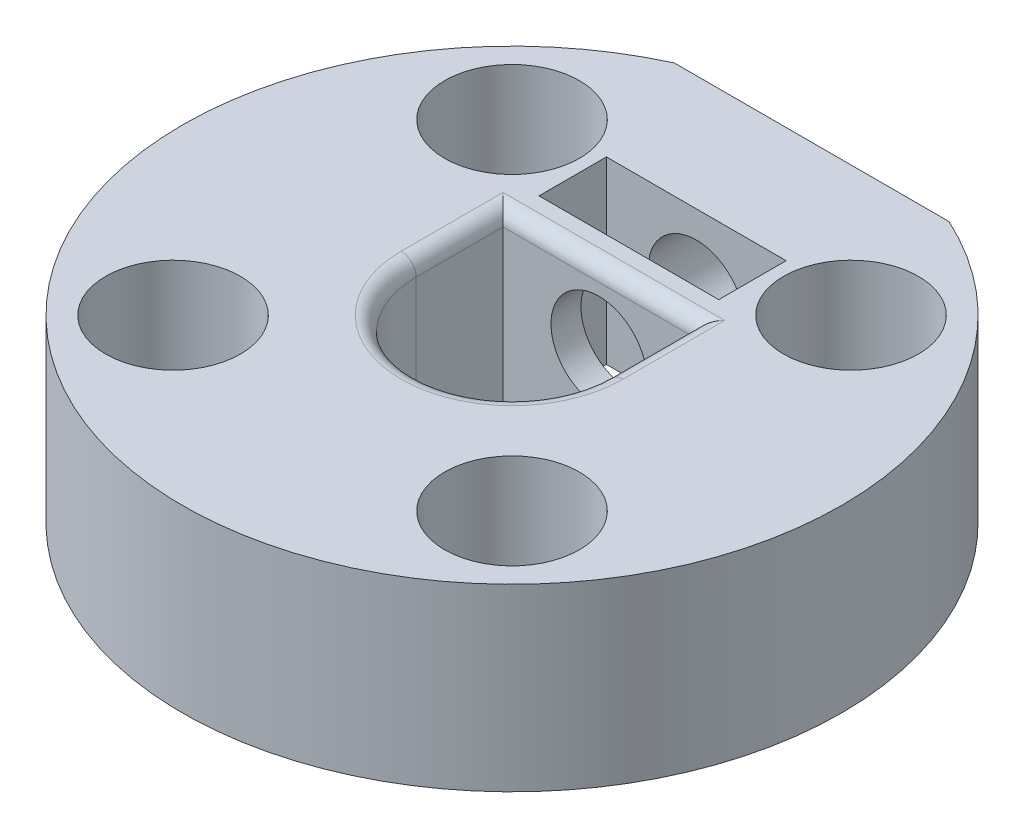
from build123d import *

# Parameters (mm, degrees)
BOSS_EXTRU_1_DEPTH                              = 6
CHAMBRAGE_POUR_VIS_T_TE_CYLINDRIQUE_D           = 2.5
CHAMBRAGE_POUR_VIS_T_TE_CYLINDRIQUE_CBORE_D     = 4.5
CHAMBRAGE_POUR_VIS_T_TE_CYLINDRIQUE_CBORE_DEPTH = 4.5
CONG_1_R                                        = 0.5
ESQUISSE6_R                                     = 1.6
ENL_V_MAT_EXTRU_1_DEPTH                         = 17.673332037
ESQUISSE7_W                                     = 6
ESQUISSE7_H                                     = 2.25
ENL_V_MAT_EXTRU_2_DEPTH                         = 17.673332001


with BuildPart() as part:
    # Esquisse1 → Boss.-Extru.1 (new body)
    with BuildSketch(Plane(origin=(0, 0, 0), x_dir=(1, 0, 0), z_dir=(0, 1, 0))):
        with BuildLine():
            Line((4.582575695, 10), (-4.582575695, 10))
            ThreePointArc((-4.582575695, 10), (0, -11), (4.582575695, 10))
        make_face()
        with BuildLine():
            Line((-3.2, 0), (-3.2, 2.9))
            Line((-3.2, 2.9), (3.2, 2.9))
            Line((3.2, 2.9), (3.2, 0))
            ThreePointArc((3.2, 0), (0, -3.2), (-3.2, 0))
        make_face(mode=Mode.SUBTRACT)
    extrude(amount=BOSS_EXTRU_1_DEPTH)

    # Chambrage pour vis à tête cylindrique à 6 pans creux (ou vis CHC) M21 (through all)
    with Locations(Plane(origin=(0, 6, 0), x_dir=(1, 0, 0), z_dir=(0, 1, 0))):
        with Locations((5.656854249, 5.656854249), (5.656854249, -5.656854249), (-5.656854249, -5.656854249), (-5.656854249, 5.656854249), (0, 0)):
            CounterBoreHole(CHAMBRAGE_POUR_VIS_T_TE_CYLINDRIQUE_D / 2, CHAMBRAGE_POUR_VIS_T_TE_CYLINDRIQUE_CBORE_D / 2, CHAMBRAGE_POUR_VIS_T_TE_CYLINDRIQUE_CBORE_DEPTH)

    # Congé1
    cong_1_edges = [part.edges().sort_by_distance(p)[0] for p in [
        (0, 6, 3.2),
        (-3.2, 6, -1.45),
        (3.2, 6, -1.45),
        (0, 6, -2.9),
    ]]
    fillet(cong_1_edges, radius=CONG_1_R)

    # Esquisse6 → Enlèv. mat.-Extru.1 (cut, through all)
    with BuildSketch(Plane.XY):
        with Locations((0, 3.5)):
            Circle(ESQUISSE6_R)
    extrude(amount=-ENL_V_MAT_EXTRU_1_DEPTH, mode=Mode.SUBTRACT)

    # Esquisse7 → Enlèv. mat.-Extru.2 (cut, through all)
    with BuildSketch(Plane(origin=(0, 6, 0), x_dir=(1, 0, 0), z_dir=(0, 1, 0))):
        with Locations((0, 5.025)):
            Rectangle(ESQUISSE7_W, ESQUISSE7_H)
    extrude(amount=-ENL_V_MAT_EXTRU_2_DEPTH, mode=Mode.SUBTRACT)


solid = part.part
